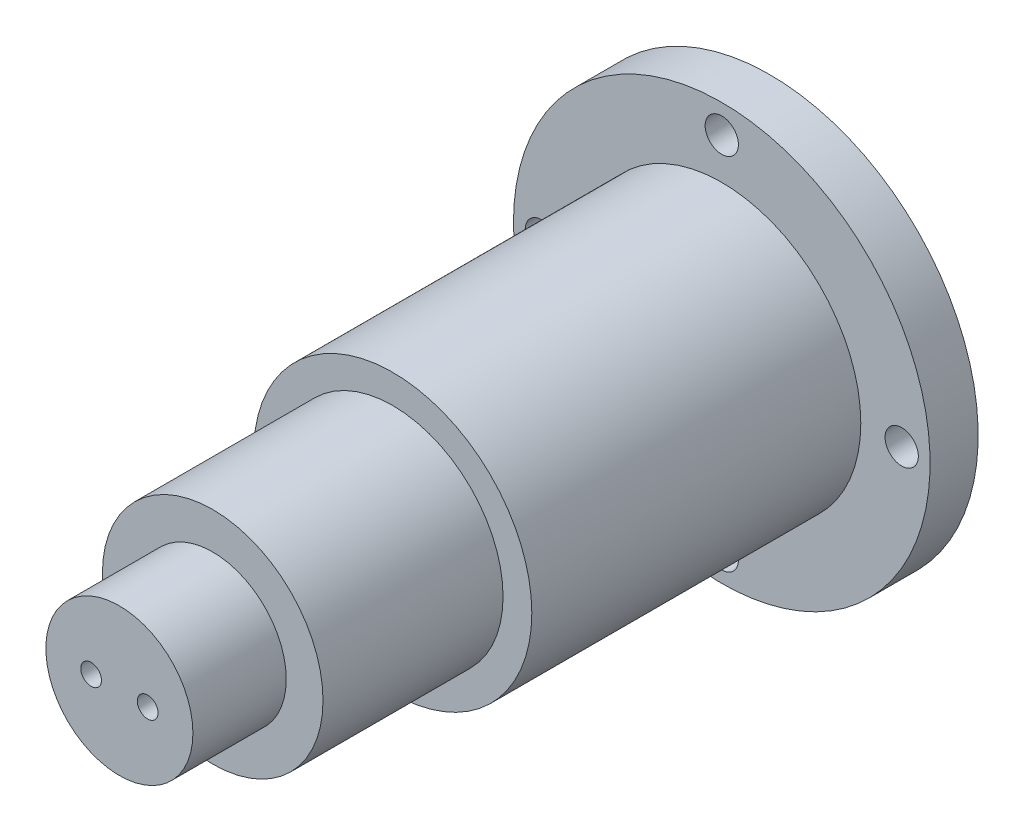
from build123d import *

# Parameters (mm, degrees)
SKETCH1_W                      = 22.1
SKETCH1_H                      = 5.1
SKETCH2_R                      = 14.75
BOSS_EXTRUDE1_DEPTH            = 34.9
SKETCH3_R                      = 11.7
BOSS_EXTRUDE2_DEPTH            = 19.1
SKETCH4_R                      = 7.8
BOSS_EXTRUDE3_DEPTH            = 9.9
M10_CLEARANCE_HOLE1_D          = 12.7
M10_CLEARANCE_HOLE1_DEPTH      = 18.81
M10_CLEARANCE_HOLE1_TIP        = 3.815464931
F_2_2_2_2_DIAMETER_HOLE1_D     = 2.2
F_2_2_2_2_DIAMETER_HOLE1_DEPTH = 15
M3_CLEARANCE_HOLE1_D           = 3.53
M3_CLEARANCE_HOLE1_DEPTH       = 69
CHAMFER1_SIZE                  = 2


with BuildPart() as part:
    # Sketch1 → Revolve1 (revolve)
    with BuildSketch(Plane.XZ):
        with Locations((11.05, 2.55)):
            Rectangle(SKETCH1_W, SKETCH1_H)
    revolve(axis=Axis((0, 0, 5.1), (0, 0, -1)))

    # Sketch2 → Boss-Extrude1 (add)
    with BuildSketch(Plane.XY.offset(5.1)):
        Circle(SKETCH2_R)
    extrude(amount=BOSS_EXTRUDE1_DEPTH)

    # Sketch3 → Boss-Extrude2 (add)
    with BuildSketch(Plane.XY.offset(40)):
        Circle(SKETCH3_R)
    extrude(amount=BOSS_EXTRUDE2_DEPTH)

    # Sketch4 → Boss-Extrude3 (add)
    with BuildSketch(Plane.XY.offset(59.1)):
        Circle(SKETCH4_R)
    extrude(amount=BOSS_EXTRUDE3_DEPTH)

    # M10 Clearance Hole1
    with Locations(Plane(origin=(0, 0, 0), x_dir=(-1, 0, 0), z_dir=(0, 0, -1))):
        with Locations((0, 0)):
            Hole(M10_CLEARANCE_HOLE1_D / 2, depth=M10_CLEARANCE_HOLE1_DEPTH)
            with Locations((0, 0, -(M10_CLEARANCE_HOLE1_DEPTH + M10_CLEARANCE_HOLE1_TIP / 2))):  # 118° drill point
                Cone(0, M10_CLEARANCE_HOLE1_D / 2, M10_CLEARANCE_HOLE1_TIP, mode=Mode.SUBTRACT)

    # Ø2.2 (2.2) Diameter Hole1
    with Locations(Plane.XY.offset(69)):
        with Locations((-3, 0), (3, 0)):
            Hole(F_2_2_2_2_DIAMETER_HOLE1_D / 2, depth=F_2_2_2_2_DIAMETER_HOLE1_DEPTH)

    # M3 Clearance Hole1
    with Locations(Plane(origin=(0, 0, 0), x_dir=(-1, 0, 0), z_dir=(0, 0, -1))):
        with Locations((0, 19.0875), (-19.0875, 0), (0, -19.0875), (19.0875, 0)):
            Hole(M3_CLEARANCE_HOLE1_D / 2, depth=M3_CLEARANCE_HOLE1_DEPTH)

    # Chamfer1
    chamfer1_edges = [part.edges().sort_by_distance(p)[0] for p in [
        (-6.35, 0, 0),
    ]]
    chamfer(chamfer1_edges, length=CHAMFER1_SIZE)


solid = part.part
